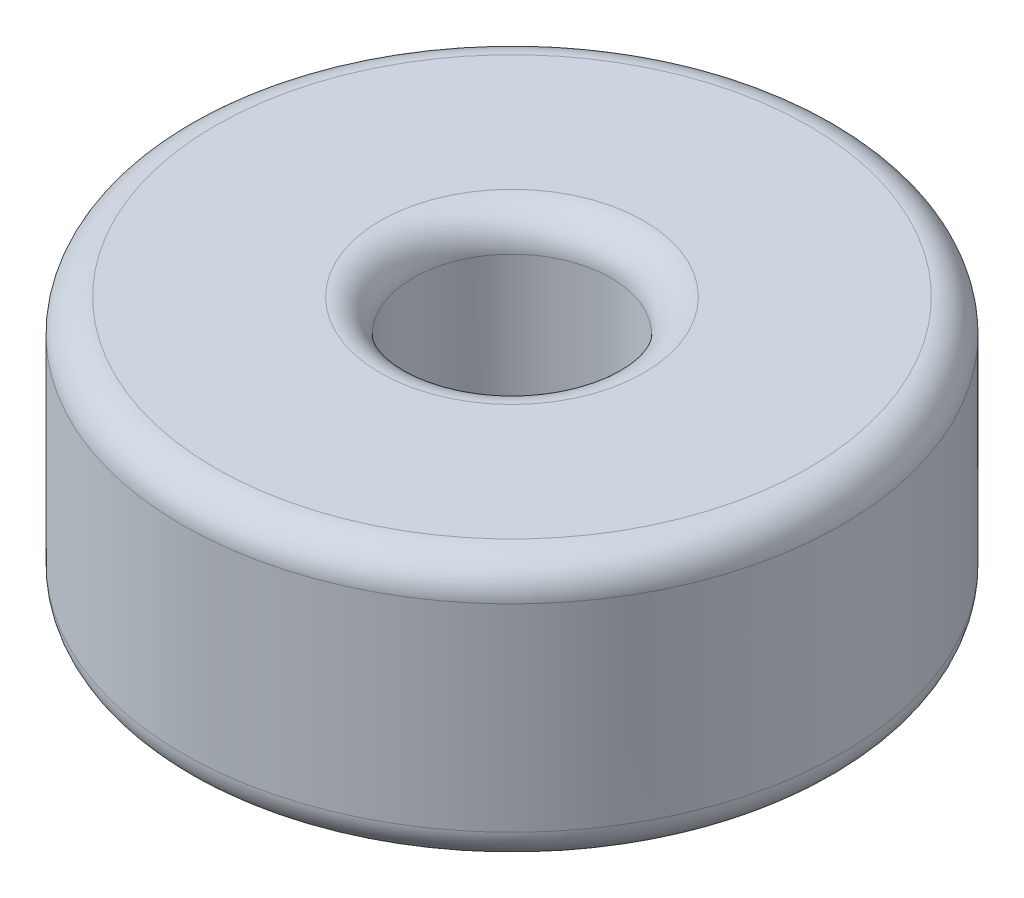
from build123d import *

# Parameters (mm, degrees)
ESQUISSE1_W = 3.5
ESQUISSE1_H = 4
CONG_1_R    = 0.5


with BuildPart() as part:
    # Esquisse1 → Révolution1 (revolve)
    with BuildSketch(Plane.XY):
        with Locations((3.25, 2)):
            Rectangle(ESQUISSE1_W, ESQUISSE1_H)
    revolve(axis=Axis((0, 0, 0), (0, 1, 0)))

    # Congé1
    cong_1_edges = [part.edges().sort_by_distance(p)[0] for p in [
        (-1.5, 0, 0),
        (-5, 0, 0),
        (-5, 4, 0),
        (-1.5, 4, 0),
    ]]
    fillet(cong_1_edges, radius=CONG_1_R)


solid = part.part
